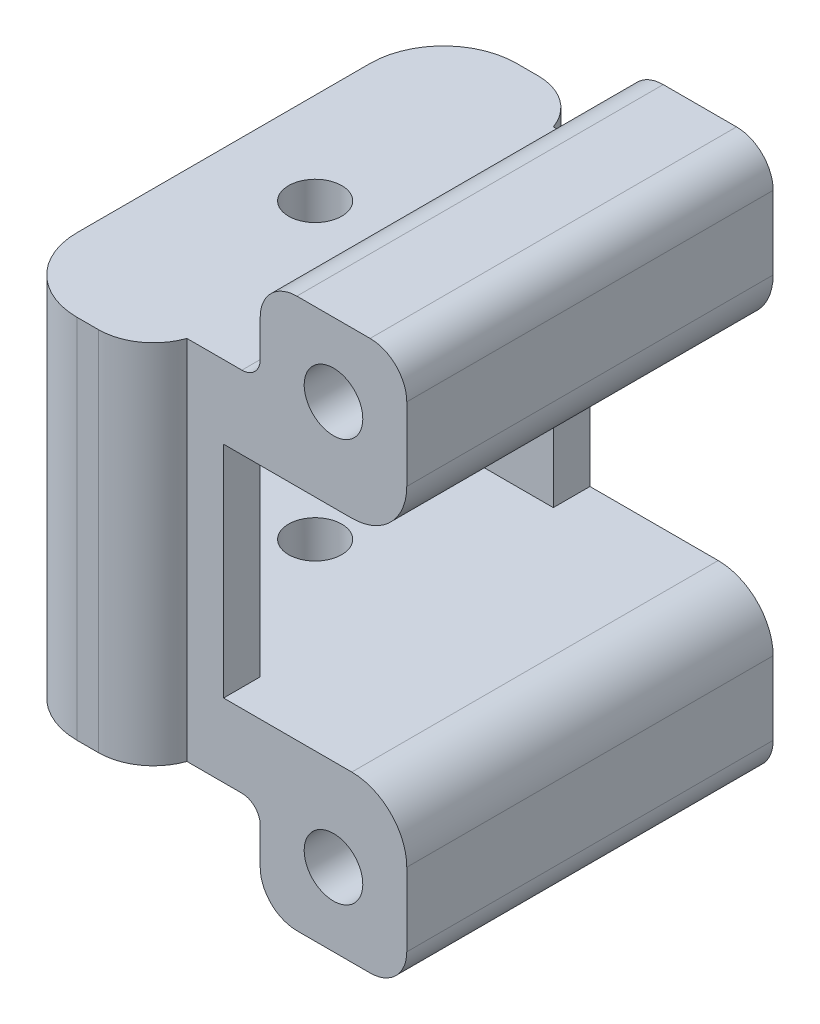
from build123d import *

# Parameters (mm, degrees)
SKETCH1_W           = 20
SKETCH1_H           = 20
BOSS_EXTRUDE1_DEPTH = 4
SKETCH2_R           = 3.7
CUT_EXTRUDE1_DEPTH  = 2.6
SKETCH3_R           = 2.1
CUT_EXTRUDE2_DEPTH  = 29.403520909
SKETCH4_W           = 12
SKETCH4_H           = 4
BOSS_EXTRUDE2_DEPTH = 12
SKETCH7_W           = 20
SKETCH7_H           = 4
BOSS_EXTRUDE3_DEPTH = 10
SKETCH8_W           = 8
SKETCH8_H           = 20
BOSS_EXTRUDE4_DEPTH = 5
SKETCH9_W           = 8
SKETCH9_H           = 20
BOSS_EXTRUDE5_DEPTH = 5
SKETCH10_R          = 1.6
CUT_EXTRUDE5_DEPTH  = 42.243181255
SKETCH11_W          = 30
SKETCH11_H          = 30
CUT_EXTRUDE6_DEPTH  = 6
SKETCH12_R          = 1.45
CUT_EXTRUDE7_DEPTH  = 42.243181255
SKETCH13_W          = 8
SKETCH13_H          = 20
BOSS_EXTRUDE6_DEPTH = 2
SKETCH14_W          = 8
SKETCH14_H          = 20
BOSS_EXTRUDE7_DEPTH = 2
SKETCH15_W          = 16
SKETCH15_H          = 12
CUT_EXTRUDE8_DEPTH  = 39.845849199
FILLET2_R           = 3
FILLET4_R           = 2
FILLET5_START       = -21
FILLET5_DEPTH       = 22
FILLET6_R           = 3
FILLET7_R           = 1
FILLET8_R           = 1


with BuildPart() as part:
    # Sketch1 → Boss-Extrude1 (new body)
    with BuildSketch(Plane(origin=(0, 0, 0), x_dir=(0, 0, -1), z_dir=(1, 0, 0))):
        with Locations((-10, -10)):
            Rectangle(SKETCH1_W, SKETCH1_H)
    extrude(amount=BOSS_EXTRUDE1_DEPTH)

    # Sketch2 → Cut-Extrude1 (cut)
    with BuildSketch(Plane(origin=(4, 0, 0), x_dir=(0, 0, -1), z_dir=(1, 0, 0))):
        with Locations((-10, -10)):
            Circle(SKETCH2_R)
    extrude(amount=-CUT_EXTRUDE1_DEPTH, mode=Mode.SUBTRACT)

    # Sketch3 → Cut-Extrude2 (cut, through all)
    with BuildSketch(Plane(origin=(1.4, 0, 0), x_dir=(0, 0, -1), z_dir=(1, 0, 0))):
        with Locations((-10, -10)):
            Circle(SKETCH3_R)
    extrude(amount=-CUT_EXTRUDE2_DEPTH, mode=Mode.SUBTRACT)

    # Sketch4 → Boss-Extrude2 (add)
    with BuildSketch(Plane(origin=(4, 0, 0), x_dir=(0, 0, -1), z_dir=(1, 0, 0))):
        Polygon((-20, 0), (-20, -20), (-16, -20), (-16, -16), (-16, -4), (-16, 0), align=None)
        with Locations((-10, -18)):
            Rectangle(SKETCH4_W, SKETCH4_H)
        Polygon((-4, -16), (-4, -20), (0, -20), (0, -4), (-4, -4), align=None)
        Polygon((0, 0), (-16, 0), (-16, -4), (-4, -4), (0, -4), align=None)
    extrude(amount=BOSS_EXTRUDE2_DEPTH)

    # Sketch7 → Boss-Extrude3 (add)
    with BuildSketch(Plane(origin=(16, 0, 0), x_dir=(0, 0, -1), z_dir=(1, 0, 0))):
        with Locations((-10, -18)):
            Rectangle(SKETCH7_W, SKETCH7_H)
        with Locations((-10, -2)):
            Rectangle(SKETCH7_W, SKETCH7_H)
    extrude(amount=BOSS_EXTRUDE3_DEPTH)

    # Sketch8 → Boss-Extrude4 (add)
    with BuildSketch(Plane(origin=(0, -20, 0), x_dir=(-1, 0, 0), z_dir=(0, -1, 0))):
        with Locations((-22, -10)):
            Rectangle(SKETCH8_W, SKETCH8_H)
    extrude(amount=BOSS_EXTRUDE4_DEPTH)

    # Sketch9 → Boss-Extrude5 (add)
    with BuildSketch(Plane(origin=(0, 0, 0), x_dir=(1, 0, 0), z_dir=(0, 1, 0))):
        with Locations((22, -10)):
            Rectangle(SKETCH9_W, SKETCH9_H)
    extrude(amount=BOSS_EXTRUDE5_DEPTH)

    # Sketch10 → Cut-Extrude5 (cut, through all)
    with BuildSketch(Plane(origin=(0, 0, 0), x_dir=(-1, 0, 0), z_dir=(0, 0, -1))):
        with Locations(Location((-22, 1, 0), (0, 0, 90))):
            Circle(SKETCH10_R)
        with Locations(Location((-22, -21, 0), (0, 0, 90))):
            Circle(SKETCH10_R)
    extrude(amount=-CUT_EXTRUDE5_DEPTH, mode=Mode.SUBTRACT)

    # Sketch11 → Cut-Extrude6 (cut)
    with BuildSketch(Plane.ZY):
        with Locations((15, -5)):
            Rectangle(SKETCH11_W, SKETCH11_H)
    extrude(amount=-CUT_EXTRUDE6_DEPTH, mode=Mode.SUBTRACT)

    # Sketch12 → Cut-Extrude7 (cut, through all)
    with BuildSketch(Plane(origin=(0, 0, 0), x_dir=(1, 0, 0), z_dir=(0, 1, 0))):
        with Locations(Location((11, -10, 0), (0, 0, 270))):
            Circle(SKETCH12_R)
    extrude(amount=-CUT_EXTRUDE7_DEPTH, mode=Mode.SUBTRACT)

    # Sketch13 → Boss-Extrude6 (add)
    with BuildSketch(Plane.XY.offset(20)):
        with Locations((10, -10)):
            Rectangle(SKETCH13_W, SKETCH13_H)
    extrude(amount=BOSS_EXTRUDE6_DEPTH)

    # Sketch14 → Boss-Extrude7 (add)
    with BuildSketch(Plane(origin=(0, 0, 0), x_dir=(-1, 0, 0), z_dir=(0, 0, -1))):
        with Locations((-10, -10)):
            Rectangle(SKETCH14_W, SKETCH14_H)
    extrude(amount=BOSS_EXTRUDE7_DEPTH)

    # Sketch15 → Cut-Extrude8 (cut, through all)
    with BuildSketch(Plane.ZY.offset(-6)):
        with Locations((10, -10)):
            Rectangle(SKETCH15_W, SKETCH15_H)
    extrude(amount=-CUT_EXTRUDE8_DEPTH, mode=Mode.SUBTRACT)

    # Fillet2
    fillet2_edges = [part.edges().sort_by_distance(p)[0] for p in [
        (26, -16, 10),
        (26, -4, 10),
    ]]
    fillet(fillet2_edges, radius=FILLET2_R)

    # Fillet4
    fillet4_edges = [part.edges().sort_by_distance(p)[0] for p in [
        (26, -25, 10),
        (18, -25, 10),
        (26, 5, 10),
        (18, 5, 10),
    ]]
    fillet(fillet4_edges, radius=FILLET4_R)

    # Fillet5: read off the stored shape, not the designer's step
    # Fillet5 outline → Fillet5 (cut)
    with BuildSketch(Plane(origin=(0, 0, 0), x_dir=(1, 0, 0), z_dir=(0, 1, 0)).offset(FILLET5_START)):
        with BuildLine():
            Line((6, 2), (6, -2))
            ThreePointArc((6, -2), (7.171572875, 0.828427125), (10, 2))
            Line((10, 2), (6, 2))
        make_face()
        with BuildLine():
            ThreePointArc((10, -22), (7.171572875, -20.828427125), (6, -18))
            Line((6, -18), (6, -22))
            Line((6, -22), (10, -22))
        make_face()
    extrude(amount=FILLET5_DEPTH, mode=Mode.SUBTRACT)

    # Fillet6
    # the kernel refuses this fillet: 3 mm, written as the material it takes off along each edge
    with BuildSketch(Plane(origin=(14, -27.071067812, -2), x_dir=(-1, 0, 0), z_dir=(0, 1, 0))) as fillet6_piece_1:
        with BuildLine():
            CenterArc((2.828427125, 3), FILLET6_R, 199.471220634, 70.528779366)
            Line((0, 2), (-0.056568542, 1.98))
            ThreePointArc((-0.056568542, 1.98), (-0.06, 1), (-0.06, 0))
            Line((-0.06, 0), (0, -0.06))
            Line((0, -0.06), (2.828427125, -0.06))
            Line((2.828427125, -0.06), (2.828427125, 0))
        make_face()
    extrude(amount=34.142135624, mode=Mode.SUBTRACT)
    with BuildSketch(Plane(origin=(14, -27.071067812, 22), x_dir=(0, 0, -1), z_dir=(0, 1, 0))) as fillet6_piece_2:
        with BuildLine():
            CenterArc((3, 2.828427125), FILLET6_R, 180, 70.528779366)
            Line((0, 2.828427125), (-0.06, 2.828427125))
            Line((-0.06, 2.828427125), (-0.06, 0))
            Line((-0.06, 0), (0, -0.06))
            ThreePointArc((0, -0.06), (1, -0.06), (1.98, -0.056568542))
            Line((1.98, -0.056568542), (2, 0))
        make_face()
    extrude(amount=34.142135624, mode=Mode.SUBTRACT)

    # Fillet7
    fillet7_edges = [part.edges().sort_by_distance(p)[0] for p in [
        (18, -20, 10),
    ]]
    fillet(fillet7_edges, radius=FILLET7_R)

    # Fillet8
    fillet8_edges = [part.edges().sort_by_distance(p)[0] for p in [
        (18, 0, 10),
    ]]
    fillet(fillet8_edges, radius=FILLET8_R)


solid = part.part
